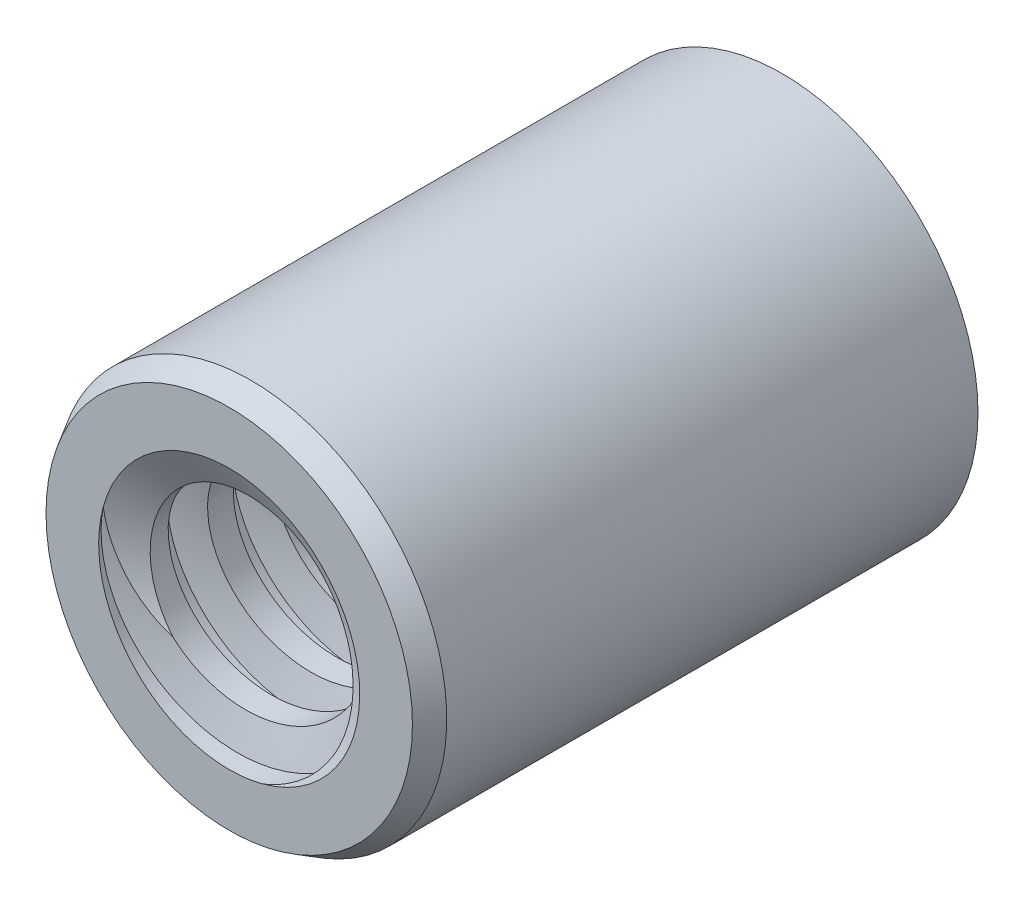
from build123d import *
from OCP.BRepFilletAPI import BRepFilletAPI_MakeChamfer

# Parameters (mm, degrees)
SKETCH_1_R      = 9
SKETCH_1_R_2    = 4.5
EXTRUDE_1_DEPTH = 26
CHAMFER_1_SIZE  = 1.5
CHAMFER_1_SIZE2 = 0.866025404
SWEEP_2_PITCH   = 3
CHAMFER_2_SIZE  = 1
CHAMFER_2_SIZE2 = 0.577350269


with BuildPart() as part:
    # Эскиз1 → Бобышка-Вытянуть1 (new body)
    with BuildSketch(Plane.XY):
        with Locations(Location((0, 0, 0), (0, 0, 180))):
            Circle(SKETCH_1_R)
        with Locations(Location((0, 0, 0), (0, 0, 180))):
            Circle(SKETCH_1_R_2, mode=Mode.SUBTRACT)
    extrude(amount=EXTRUDE_1_DEPTH)

    # Фаска1: one chamfer whose edges measure the first distance from different faces: ONE call of the kernel's chamfer builder (chamfer() names one face for all edges)
    chamfer_1_edges_1 = [part.edges().sort_by_distance(p)[0] for p in [
        (4.5, 0, 0),
    ]]
    chamfer_1_side_1 = [part.faces().sort_by_distance(p)[0] for p in [
        (4.5, 0, 13),
    ]]
    chamfer_1_edges_2 = [part.edges().sort_by_distance(p)[0] for p in [
        (4.5, 0, 26),
    ]]
    chamfer_1_side_2 = [part.faces().sort_by_distance(p)[0] for p in [
        (8.745441559, 0, 26),
    ]]
    chamfer_1 = BRepFilletAPI_MakeChamfer(part.part.solid().wrapped)
    for e in chamfer_1_edges_1:
        chamfer_1.Add(CHAMFER_1_SIZE, CHAMFER_1_SIZE2, e.wrapped, chamfer_1_side_1[0].wrapped)  # the first distance lies on this face
    for e in chamfer_1_edges_2:
        chamfer_1.Add(CHAMFER_1_SIZE, CHAMFER_1_SIZE2, e.wrapped, chamfer_1_side_2[0].wrapped)  # the first distance lies on this face
    add(Compound.cast(chamfer_1.Shape()), mode=Mode.REPLACE)

    # Вырез-По траектории2: arcs per turn and ends read off the stored shape
    # Вырез-По траектории2: the profile of Эскиз4 screwed along a left-hand helix through 10.25 turns, 10 arcs to a turn; built about Z, then put on its axis
    sweep_2_z = Axis((0, 0, 0), (0, 0, 1))
    sweep_2_corners = [(6, -0.039663348, -3.498424336), (4.49, -0.07175919, -3.901752579), (4.49, 0.07175919, -2.098247421), (6, 0.039663348, -2.501575664)]
    with BuildLine(mode=Mode.PRIVATE) as sweep_2_profile:
        Line(sweep_2_corners[0], sweep_2_corners[1])
        Line(sweep_2_corners[1], sweep_2_corners[2])
        Line(sweep_2_corners[2], sweep_2_corners[3])
        Line(sweep_2_corners[3], sweep_2_corners[0])
    sweep_2_cap = Face(sweep_2_profile.wire())
    sweep_2_turn_angles = [0, -18, -36, -54, -72, -90, -108, -126, -144, -162, -180, -198, -216, -234, -252, -270, -288, -306, -324, -342, -360]
    sweep_2_turn_weights = [1, 0.9510565162951535, 1, 0.9510565162951535, 1, 0.9510565162951535, 1, 0.9510565162951535, 1, 0.9510565162951535, 1, 0.9510565162951535, 1, 0.9510565162951535, 1, 0.9510565162951535, 1, 0.9510565162951535, 1, 0.9510565162951535, 1]
    sweep_2_turn_rails = [Edge.make_bspline([Vector(p[0], p[1], 0).rotate(sweep_2_z, sweep_2_turn_angles[k]) / sweep_2_turn_weights[k] + Vector(0, 0, p[2] + -SWEEP_2_PITCH * sweep_2_turn_angles[k] / 360) for k in range(21)], [0, 0, 0, 1, 1, 2, 2, 3, 3, 4, 4, 5, 5, 6, 6, 7, 7, 8, 8, 9, 9, 10, 10, 10], 2, sweep_2_turn_weights) for p in sweep_2_corners]
    sweep_2_turn_sides = [Face.make_surface_from_curves(sweep_2_turn_rails[p[0]], sweep_2_turn_rails[p[1]]) for p in [(0, 1), (1, 2), (2, 3), (3, 0)]]
    sweep_2_last_angles = [-3600, -3618, -3636, -3654, -3672, -3681, -3690]
    sweep_2_last_weights = [1, 0.9510565162951535, 1, 0.9510565162951535, 1, 0.9876883405951378, 1]
    sweep_2_last_rails = [Edge.make_bspline([Vector(p[0], p[1], 0).rotate(sweep_2_z, sweep_2_last_angles[k]) / sweep_2_last_weights[k] + Vector(0, 0, p[2] + -SWEEP_2_PITCH * sweep_2_last_angles[k] / 360) for k in range(7)], [0, 0, 0, 1, 1, 2, 2, 3, 3, 3], 2, sweep_2_last_weights) for p in sweep_2_corners]
    sweep_2_last_sides = [Face.make_surface_from_curves(sweep_2_last_rails[p[0]], sweep_2_last_rails[p[1]]) for p in [(0, 1), (1, 2), (2, 3), (3, 0)]]
    sweep_2 = Plane(origin=(0, 0, 26), x_dir=(-0.7071067811865414, -0.7071067811865538, 0), z_dir=(0, 0, -1)) * Solid(Shell([*[p.moved(Location((0, 0, SWEEP_2_PITCH * i))) for i in range(10) for p in sweep_2_turn_sides], *sweep_2_last_sides, sweep_2_cap, sweep_2_cap.rotate(sweep_2_z, -3690).moved(Location((0, 0, -SWEEP_2_PITCH * -3690 / 360)))]))
    add(sweep_2, mode=Mode.SUBTRACT)

    # Фаска2: one chamfer whose edges measure the first distance from different faces: ONE call of the kernel's chamfer builder (chamfer() names one face for all edges)
    chamfer_2_edges_1 = [part.edges().sort_by_distance(p)[0] for p in [
        (9, 0, 0),
    ]]
    chamfer_2_side_1 = [part.faces().sort_by_distance(p)[0] for p in [
        (8.745441556, 0, 0),
    ]]
    chamfer_2_edges_2 = [part.edges().sort_by_distance(p)[0] for p in [
        (9, 0, 26),
    ]]
    chamfer_2_side_2 = [part.faces().sort_by_distance(p)[0] for p in [
        (9, 0, 13),
    ]]
    chamfer_2 = BRepFilletAPI_MakeChamfer(part.part.solid().wrapped)
    for e in chamfer_2_edges_1:
        chamfer_2.Add(CHAMFER_2_SIZE, CHAMFER_2_SIZE2, e.wrapped, chamfer_2_side_1[0].wrapped)  # the first distance lies on this face
    for e in chamfer_2_edges_2:
        chamfer_2.Add(CHAMFER_2_SIZE, CHAMFER_2_SIZE2, e.wrapped, chamfer_2_side_2[0].wrapped)  # the first distance lies on this face
    add(Compound.cast(chamfer_2.Shape()), mode=Mode.REPLACE)


solid = part.part
